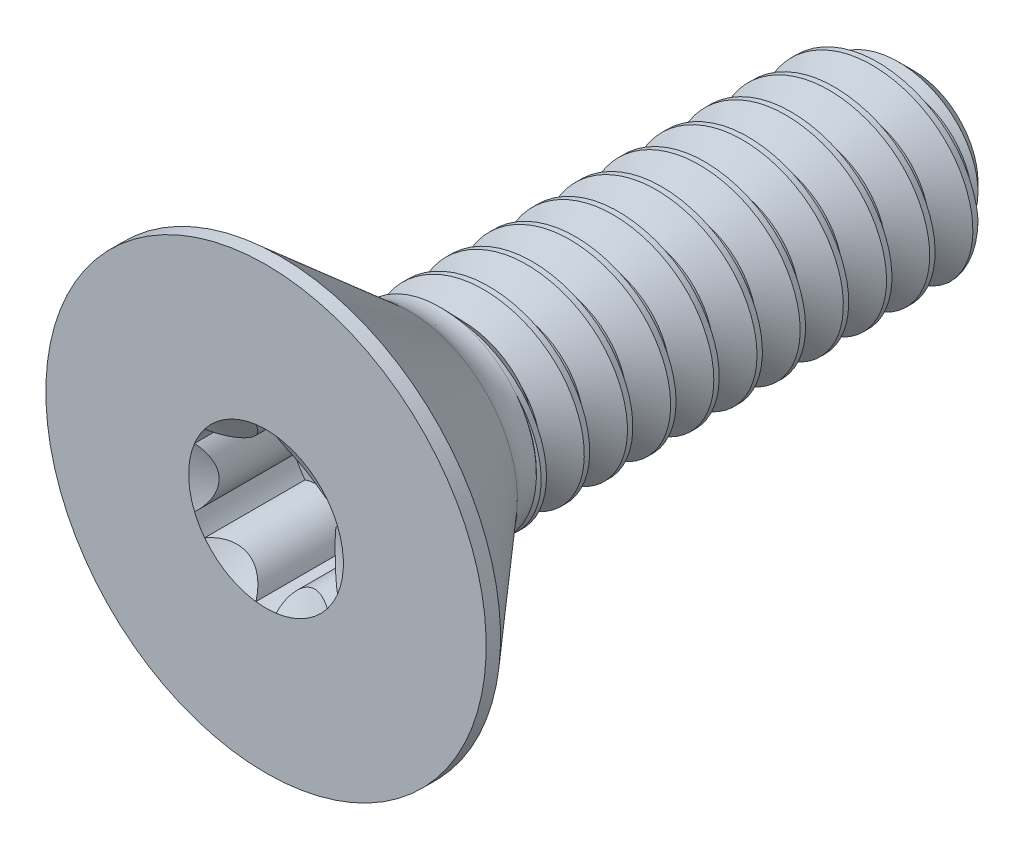
from build123d import *

# Parameters (mm, degrees)
SKETCH1_W          = 9.525
SKETCH1_H          = 1.4224
CHAMFER1_SIZE      = 0.47625
CUT_SWEEP1_PITCH   = 0.635
CUT_EXTRUDE2_DEPTH = 1.47574
CIRPATTERN1_COUNT  = 6


with BuildPart() as part:
    # Sketch1 → Revolve1 (revolve)
    with BuildSketch(Plane(origin=(0, 0, 0), x_dir=(0, 0, -1), z_dir=(1, 0, 0))):
        with Locations((4.7625, 0.7112)):
            Rectangle(SKETCH1_W, SKETCH1_H)
    revolve(axis=Axis((0, 0, -9.525), (0, 0, 1)))

    # Chamfer1
    chamfer1_edges = [part.edges().sort_by_distance(p)[0] for p in [
        (0, -1.4224, -9.525),
    ]]
    chamfer(chamfer1_edges, length=CHAMFER1_SIZE)

    # Cut-Sweep1: arcs per turn and ends read off the stored shape
    # Cut-Sweep1: the profile of Sketch2 profile screwed along a right-hand helix through 16 turns, 6 arcs to a turn; built about Z, then put on its axis
    cut_sweep1_z = Axis((0, 0, 0), (0, 0, 1))
    cut_sweep1_corners = [(1.423, 0, 0.00034641), (1.423, 0, -0.55597141), (1.009955401, 0, -0.3175), (1.009955401, 0, -0.238125)]
    with BuildLine(mode=Mode.PRIVATE) as cut_sweep1_profile:
        Line(cut_sweep1_corners[0], cut_sweep1_corners[1])
        Line(cut_sweep1_corners[1], cut_sweep1_corners[2])
        Line(cut_sweep1_corners[2], cut_sweep1_corners[3])
        Line(cut_sweep1_corners[3], cut_sweep1_corners[0])
    cut_sweep1_cap = Face(cut_sweep1_profile.wire())
    cut_sweep1_turn_angles = [0, 30, 60, 90, 120, 150, 180, 210, 240, 270, 300, 330, 360]
    cut_sweep1_turn_weights = [1, 0.8660254037844387, 1, 0.8660254037844387, 1, 0.8660254037844387, 1, 0.8660254037844387, 1, 0.8660254037844387, 1, 0.8660254037844387, 1]
    cut_sweep1_turn_rails = [Edge.make_bspline([Vector(p[0], p[1], 0).rotate(cut_sweep1_z, cut_sweep1_turn_angles[k]) / cut_sweep1_turn_weights[k] + Vector(0, 0, p[2] + CUT_SWEEP1_PITCH * cut_sweep1_turn_angles[k] / 360) for k in range(13)], [0, 0, 0, 1, 1, 2, 2, 3, 3, 4, 4, 5, 5, 6, 6, 6], 2, cut_sweep1_turn_weights) for p in cut_sweep1_corners]
    cut_sweep1_turn_sides = [Face.make_surface_from_curves(cut_sweep1_turn_rails[p[0]], cut_sweep1_turn_rails[p[1]]) for p in [(0, 1), (1, 2), (2, 3), (3, 0)]]
    cut_sweep1 = Plane(origin=(0, 0, -9.525), x_dir=(0, 1, 0), z_dir=(0, 0, 1)) * Solid(Shell([*[p.moved(Location((0, 0, CUT_SWEEP1_PITCH * i))) for i in range(16) for p in cut_sweep1_turn_sides], cut_sweep1_cap, cut_sweep1_cap.rotate(cut_sweep1_z, 5760).moved(Location((0, 0, CUT_SWEEP1_PITCH * 5760 / 360)))]))
    add(cut_sweep1, mode=Mode.SUBTRACT)

    # Sketch7 → Revolve2 (revolve)
    with BuildSketch(Plane(origin=(0, 0, 0), x_dir=(0, 0, -1), z_dir=(1, 0, 0)), mode=Mode.PRIVATE) as revolve2_sk:
        with BuildLine():
            Line((0, 3.2385), (0.21082, 3.2385))
            Line((0.21082, 3.2385), (2.1082, 1.589132729))
            ThreePointArc((2.1082, 1.589132729), (2.316098376, 1.465446193), (2.554146942, 1.4224))
            Line((2.554146942, 1.4224), (2.554146942, 0))
            Line((2.554146942, 0), (0, 0))
            Line((0, 0), (0, 3.2385))
        make_face()
    revolve(revolve2_sk.sketch.rotate(Axis((0, 0, 0), (0, 0, -1)), 189.336081704), axis=Axis((0, 0, 0), (0, 0, -1)))

    # Boss-Extrude1 cone 1 section (through the dimple's axis) → Boss-Extrude1 (revolve)
    with BuildSketch(Plane(origin=(0, 0, -2.554146942), x_dir=(0, -1, 0), z_dir=(1, 0, 0))):
        Polygon((0, 0), (1.4224, 0), (0, 1.373595713), align=None)
    revolve(axis=Axis((0, 0, -2.554146942), (0, 0, -1)))

    # Sketch5 → Cut-Extrude2 (cut)
    with BuildSketch(Plane.XY):
        with BuildLine():
            Line((-0.985467627, -0.56896), (0, 0))
            Line((0, 0), (-0.985467627, 0.56896))
            ThreePointArc((-0.985467627, 0.56896), (-1.02056943, 0.503289146), (-1.051300998, 0.435463131))
            ThreePointArc((-1.051300998, 0.435463131), (-0.85344, 0), (-1.051300998, -0.435463131))
            ThreePointArc((-1.051300998, -0.435463131), (-1.02056943, -0.503289146), (-0.985467627, -0.56896))
        make_face()
    cut_extrude2 = extrude(amount=-CUT_EXTRUDE2_DEPTH, mode=Mode.SUBTRACT)

    # CirPattern1: Cut-Extrude2 ×6 about axis
    cirpattern1_axis = Axis((0, 0, 0), (0, 0, 1))
    for i in range(1, CIRPATTERN1_COUNT):
        add(cut_extrude2.rotate(cirpattern1_axis, i * 360 / CIRPATTERN1_COUNT), mode=Mode.SUBTRACT)

    # Cut-Extrude3 cone 1 section (through the dimple's axis) → Cut-Extrude3 (revolve, cut)
    with BuildSketch(Plane(origin=(0, 0, 0), x_dir=(0, -1, 0), z_dir=(1, 0, 0))):
        Polygon((0, 0), (1.13792, 0), (0, 0.656978418), align=None)
    revolve(axis=Axis((0, 0, 0), (0, 0, -1)), mode=Mode.SUBTRACT)


solid = part.part
